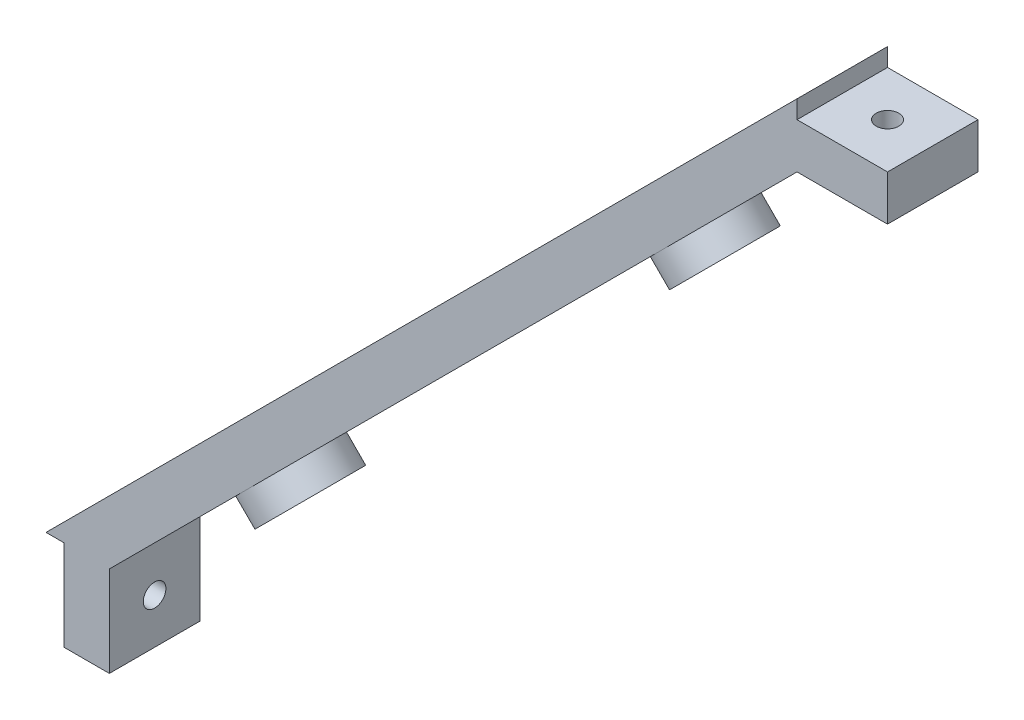
from build123d import *

# Parameters (mm, degrees)
MAIN_DEPTH          = 5
SKETCH2_R           = 1.25
FIXHOLE1_DEPTH      = 98.807208323
SKETCH3_R           = 1.25
FIXHOLE2_DEPTH      = 98.807208323
SKETCH6_R           = 1.25
CUT_EXTRUDE2_DEPTH  = 69.066144301
LPATTERN1_COUNT     = 5
LPATTERN1_PITCH     = 20
SKETCH7_R           = 5
BOSS_EXTRUDE1_DEPTH = 3
SKETCH8_R           = 1.25
CUT_EXTRUDE3_DEPTH  = 67.826923181


with BuildPart() as part:
    # Sketch1 → Main (new, symmetric)
    with BuildSketch(Plane.XY):
        Polygon((-41.5, -41.5), (41.5, 41.5), (41.5, 39.5), (51.5, 39.5), (51.5, 34.5), (41.5, 34.5), (-34.5, -41.5), (-34.5, -51.5), (-39.5, -51.5), (-39.5, -41.5), align=None)
    extrude(amount=MAIN_DEPTH, both=True)

    # Sketch2 → FixHole1 (cut, through all)
    with BuildSketch(Plane(origin=(41.5, 0, 0), x_dir=(0, 0, -1), z_dir=(1, 0, 0))):
        with Locations((0, -46.5)):
            Circle(SKETCH2_R)
    extrude(amount=-FIXHOLE1_DEPTH, mode=Mode.SUBTRACT)

    # Sketch3 → FixHole2 (cut, through all)
    with BuildSketch(Plane(origin=(0, -41.5, 0), x_dir=(-1, 0, 0), z_dir=(0, -1, 0))):
        with Locations((-46.5, 0)):
            Circle(SKETCH3_R)
    extrude(amount=-FIXHOLE2_DEPTH, mode=Mode.SUBTRACT)

    # Sketch6 → Cut-Extrude2 (cut, through all)
    with BuildSketch(Plane(origin=(3.5, -3.5, 0), x_dir=(0, 0, 1), z_dir=(-0.7071067811865489, 0.7071067811865461, 0))):
        with Locations((0, 40)):
            Circle(SKETCH6_R)
    cut_extrude2 = extrude(amount=CUT_EXTRUDE2_DEPTH, mode=Mode.SUBTRACT)

    # LPattern1: Cut-Extrude2 ×5
    with Locations(*[Vector(-0.7071067811865461, -0.7071067811865489, 0) * (i * LPATTERN1_PITCH) for i in range(1, LPATTERN1_COUNT)]):
        add(cut_extrude2, mode=Mode.SUBTRACT)

    # Sketch7 → Boss-Extrude1 (add)
    with BuildSketch(Plane(origin=(3.5, -3.5, 0), x_dir=(0, 0, 1), z_dir=(-0.7071067811865488, 0.7071067811865464, 0))):
        with Locations((0, -32.4)):
            Circle(SKETCH7_R)
        with Locations((0, 32.4)):
            Circle(SKETCH7_R)
    extrude(amount=-BOSS_EXTRUDE1_DEPTH)

    # Sketch8 → Cut-Extrude3 (cut, through all)
    with BuildSketch(Plane(origin=(5.621320344, -5.621320344, 0), x_dir=(0, 0, -1), z_dir=(0.7071067811865488, -0.7071067811865464, 0))):
        with Locations((0, 32.4)):
            Circle(SKETCH8_R)
        with Locations((0, -32.4)):
            Circle(SKETCH8_R)
    extrude(amount=-CUT_EXTRUDE3_DEPTH, mode=Mode.SUBTRACT)


solid = part.part
